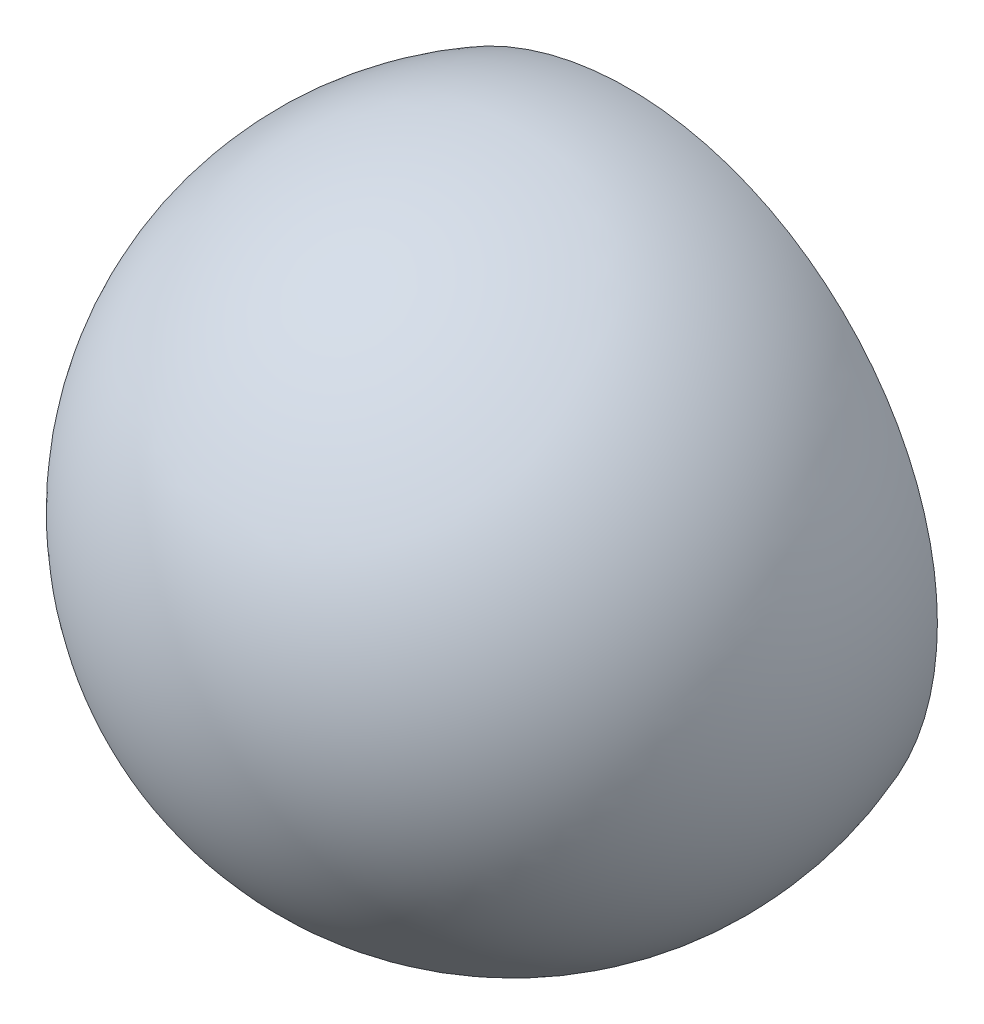
from build123d import *

# Parameters (mm, degrees)
SKETCH_4_R              = 215
SKETCH_4_R_2            = 210
EXTRUDE_1_DEPTH         = 175
CUT_EXTRUDE_START       = -162.5
CUT_EXTRUDE_3_OUTLINE_W = 472
CUT_EXTRUDE_3_OUTLINE_H = 472
CUT_EXTRUDE_3_DEPTH     = 162.5


# Read off the part's stored shape, not the designer's step: 切除-拉伸3
with BuildPart() as part:
    # 草图4 → 凸台-拉伸1 (new body)
    with BuildSketch(Plane.XY):
        Circle(SKETCH_4_R)
        Circle(SKETCH_4_R_2, mode=Mode.SUBTRACT)
    extrude(amount=EXTRUDE_1_DEPTH)


with BuildPart() as body_2:
    # 草图5 → 旋转5 (revolve)
    with BuildSketch(Plane(origin=(0, 0, 0), x_dir=(0, 0, -1), z_dir=(1, 0, 0))):
        with BuildLine():
            Line((-87.5, -250), (-87.5, 250))
            ThreePointArc((-87.5, 250), (162.5, 0), (-87.5, -250))
        make_face()
    revolve(axis=Axis((0, -250, 87.5), (0, 1, 0)))

    # 切除-拉伸3 outline → 切除-拉伸3 (cut)
    with BuildSketch(Plane.XY.offset(CUT_EXTRUDE_START)):
        Rectangle(CUT_EXTRUDE_3_OUTLINE_W, CUT_EXTRUDE_3_OUTLINE_H)
    extrude(amount=CUT_EXTRUDE_3_DEPTH, mode=Mode.SUBTRACT)


with BuildPart() as cut_revolve_2_tool:
    # 草图8 → 切除-旋转2 (revolve)
    with BuildSketch(Plane.XY):
        with BuildLine():
            Line((0, -230), (0, 230))
            ThreePointArc((0, 230), (230, 0), (0, -230))
        make_face()
    revolve(axis=Axis((0, -230, 0), (0, 1, 0)))


with BuildPart() as part_1:
    add(part.part)

    # 切除-旋转2: cut by cut_revolve_2_tool
    add(cut_revolve_2_tool.part, mode=Mode.SUBTRACT)


with BuildPart() as body_2_1:
    add(body_2.part)

    # 切除-旋转2: cut by cut_revolve_2_tool
    add(cut_revolve_2_tool.part, mode=Mode.SUBTRACT)


solid = Compound([part_1.part, body_2_1.part])
